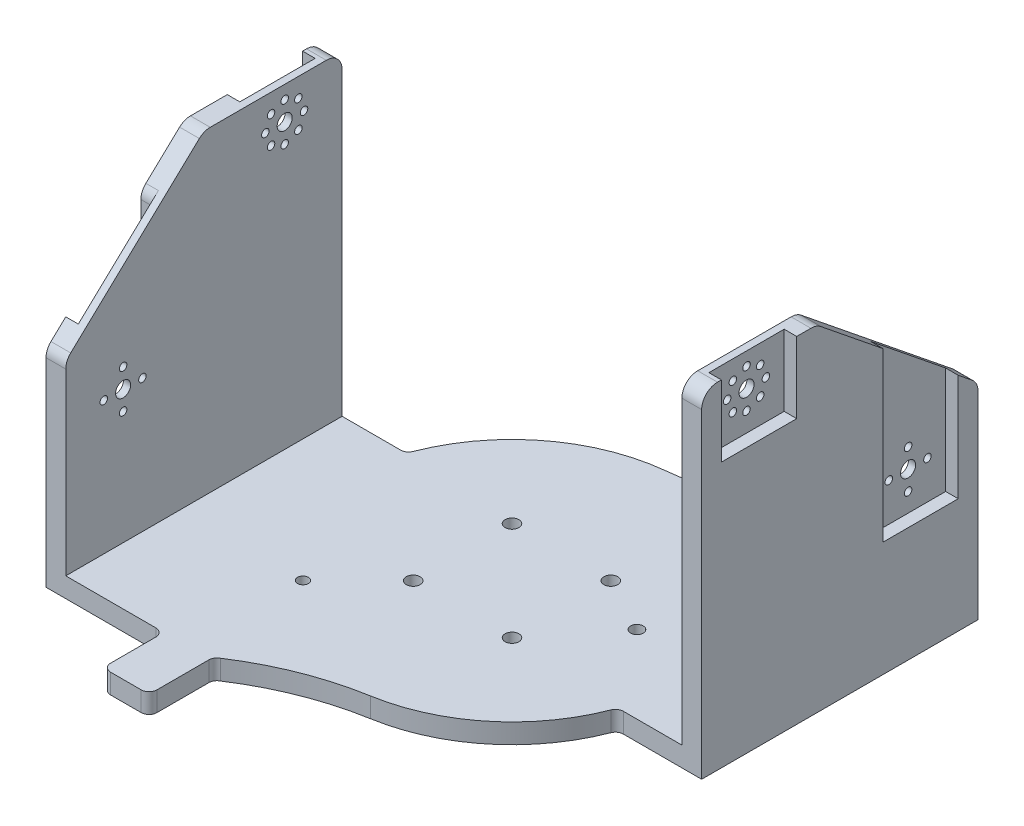
from build123d import *

# Parameters (mm, degrees)
SKETCH2_W                      = 230
SKETCH2_H                      = 283.251
BOSS_EXTRUDE1_DEPTH            = 10
SKETCH3_W                      = 10
SKETCH3_H                      = 283.251
BOSS_EXTRUDE2_DEPTH            = 170
M6_CLEARANCE_HOLE1_D           = 7
CUT_EXTRUDE1_DEPTH             = 327.431895271
CUT_EXTRUDE1_DEPTH_BACK        = 327.431895271
SKETCH7_R                      = 3.81
SKETCH7_R_2                    = 1.89865
SKETCH8_W                      = 6.35
SKETCH8_H                      = 38.1
CUT_EXTRUDE2_DEPTH             = 36.025
CUT_EXTRUDE3_DEPTH             = 6.35
CUT_EXTRUDE4_REACH             = 331.125
SKETCH11_R                     = 3.81
F_6_CLEARANCE_HOLE1_D          = 3.7973
F_6_CLEARANCE_HOLE1_DEPTH      = 3.65
CIRPATTERN1_COUNT              = 2
ENL_V_MAT_EXTRU_1_REACH        = 249.554
ESQUISSE1_R                    = 3.175
CBORE_FOR_M5_SHCS1_D           = 5.5
CBORE_FOR_M5_SHCS1_CBORE_D     = 10
CBORE_FOR_M5_SHCS1_CBORE_DEPTH = 5
CUT_EXTRUDE5_DEPTH             = 248.553594703
CUT_EXTRUDE5_DEPTH_BACK        = 248.553594703
SKETCH15_W                     = 58.825
SKETCH15_H                     = 30.860637148
CUT_EXTRUDE7_DEPTH             = 248.553594703
CUT_EXTRUDE7_DEPTH_BACK        = 248.553594703
SKETCH20_W                     = 0.765
SKETCH20_H                     = 30.860637148
FILLET2_R                      = 4
FILLET3_R                      = 144
FILLET4_R                      = 4
CUT_EXTRUDE8_REACH             = 335.853
CUT_EXTRUDE9_REACH             = 335.853
FILLET5_R                      = 8
FILLET6_R                      = 8


with BuildPart() as part:
    # Sketch2 → Boss-Extrude1 (new body)
    with BuildSketch(Plane(origin=(0, 0, 0), x_dir=(1, 0, 0), z_dir=(0, 1, 0))):
        Rectangle(SKETCH2_W, SKETCH2_H)
    extrude(amount=BOSS_EXTRUDE1_DEPTH)

    # Sketch3 → Boss-Extrude2 (add)
    with BuildSketch(Plane(origin=(0, 0, 0), x_dir=(1, 0, 0), z_dir=(0, 1, 0))):
        with Locations((-120, 0)):
            Rectangle(SKETCH3_W, SKETCH3_H)
        with Locations((120, 0)):
            Rectangle(SKETCH3_W, SKETCH3_H)
    extrude(amount=BOSS_EXTRUDE2_DEPTH)

    # M6 Clearance Hole1 (through all)
    with Locations(Plane(origin=(0, 10, 0), x_dir=(1, 0, 0), z_dir=(0, 1, 0))):
        with Locations((-25, 25), (25, 25), (25, -25), (-25, -25)):
            Hole(M6_CLEARANCE_HOLE1_D / 2)

    # Sketch7 → Cut-Extrude1 (cut, two sides: drawn at the far end of the back side and taken through both)
    with BuildSketch(Plane.ZY.offset(-115).offset(-CUT_EXTRUDE1_DEPTH_BACK)):
        with Locations((0, 153.49)):
            Circle(SKETCH7_R)
        with Locations((0, 163.269)):
            Circle(SKETCH7_R_2)
        with Locations((6.914797213, 160.404797213)):
            Circle(SKETCH7_R_2)
        with Locations((9.779, 153.49)):
            Circle(SKETCH7_R_2)
        with Locations((6.914797213, 146.575202787)):
            Circle(SKETCH7_R_2)
        with Locations((0, 143.711)):
            Circle(SKETCH7_R_2)
        with Locations((-6.914797213, 146.575202787)):
            Circle(SKETCH7_R_2)
        with Locations((-9.779, 153.49)):
            Circle(SKETCH7_R_2)
        with Locations((-6.914797213, 160.404797213)):
            Circle(SKETCH7_R_2)
    extrude(amount=CUT_EXTRUDE1_DEPTH + CUT_EXTRUDE1_DEPTH_BACK, mode=Mode.SUBTRACT)

    # Sketch8 → Cut-Extrude2 (cut)
    with BuildSketch(Plane(origin=(0, 170, 0), x_dir=(1, 0, 0), z_dir=(0, 1, 0))):
        with Locations((121.825, 0)):
            Rectangle(SKETCH8_W, SKETCH8_H)
        with Locations((-121.825, 0)):
            Rectangle(SKETCH8_W, SKETCH8_H)
    extrude(amount=-CUT_EXTRUDE2_DEPTH, mode=Mode.SUBTRACT)

    # Sketch9 → Cut-Extrude3 (cut)
    with BuildSketch(Plane(origin=(125, 0, 0), x_dir=(0, 0, -1), z_dir=(1, 0, 0))):
        Polygon((100.764862852, 96.554), (100.764862852, 58.026), (62.744862852, 58.026), (62.744862852, 96.554), (62.744862852, 170), (100.764862852, 170), align=None)
    cut_extrude3 = extrude(amount=-CUT_EXTRUDE3_DEPTH, mode=Mode.SUBTRACT)

    # Sketch11 → Cut-Extrude4 (cut, up to next)
    with BuildSketch(Plane(origin=(118.65, 0, 0), x_dir=(0, 0, -1), z_dir=(1, 0, 0)), mode=Mode.PRIVATE) as cut_extrude4_sk1:
        with Locations((81.754862852, 77.29)):
            Circle(SKETCH11_R)
    cut_extrude4_tool1 = extrude(cut_extrude4_sk1.sketch, amount=-CUT_EXTRUDE4_REACH, mode=Mode.PRIVATE) & part.part
    cut_extrude4 = cut_extrude4_tool1.solids().sort_by_distance((118.65, 77.29, -81.754863))[0]
    add(cut_extrude4, mode=Mode.SUBTRACT)

    # #6 Clearance Hole1
    with Locations(Plane(origin=(118.65, 0, 0), x_dir=(0, 0, -1), z_dir=(1, 0, 0))):
        with Locations((81.754862852, 87.069), (71.975862852, 77.29), (91.533862852, 77.29), (81.754862852, 67.511)):
            f_6_clearance_hole1 = Hole(F_6_CLEARANCE_HOLE1_D / 2, depth=F_6_CLEARANCE_HOLE1_DEPTH)

    # CirPattern1: Cut-Extrude3, Cut-Extrude4, #6 Clearance Hole1 ×2 about axis
    cirpattern1_axis = Axis((0, 0, 0), (0, 1, 0))
    add([cut_extrude3.rotate(cirpattern1_axis, i * 360 / CIRPATTERN1_COUNT) for i in range(1, CIRPATTERN1_COUNT)], mode=Mode.SUBTRACT)
    add([cut_extrude4.rotate(cirpattern1_axis, i * 360 / CIRPATTERN1_COUNT) for i in range(1, CIRPATTERN1_COUNT)], mode=Mode.SUBTRACT)
    add([f_6_clearance_hole1.rotate(cirpattern1_axis, i * 360 / CIRPATTERN1_COUNT) for i in range(1, CIRPATTERN1_COUNT)], mode=Mode.SUBTRACT)

    # Esquisse1 → Enlèv. mat.-Extru.1 (cut, up to next)
    with BuildSketch(Plane(origin=(0, 10, 0), x_dir=(1, 0, 0), z_dir=(0, 1, 0)), mode=Mode.PRIVATE) as enl_v_mat_extru_1_sk1:
        with Locations(Location((53, 110.739314032, 0), (0, 0, 270))):
            Circle(ESQUISSE1_R)
    enl_v_mat_extru_1_tool1 = extrude(enl_v_mat_extru_1_sk1.sketch, amount=-ENL_V_MAT_EXTRU_1_REACH, mode=Mode.PRIVATE) & part.part
    # Esquisse1 → Enlèv. mat.-Extru.1 (cut, up to next)
    with BuildSketch(Plane(origin=(0, 10, 0), x_dir=(1, 0, 0), z_dir=(0, 1, 0)), mode=Mode.PRIVATE) as enl_v_mat_extru_1_sk2:
        with Locations(Location((53, 10.203163452, 0), (0, 0, 270))):
            Circle(ESQUISSE1_R)
    enl_v_mat_extru_1_tool2 = extrude(enl_v_mat_extru_1_sk2.sketch, amount=-ENL_V_MAT_EXTRU_1_REACH, mode=Mode.PRIVATE) & part.part
    add(enl_v_mat_extru_1_tool1.solids().sort_by_distance((53, 10, -110.739314))[0], mode=Mode.SUBTRACT)
    add(enl_v_mat_extru_1_tool2.solids().sort_by_distance((53, 10, -10.203163))[0], mode=Mode.SUBTRACT)

    # CBORE for M5 SHCS1 (through all)
    with Locations(Plane(origin=(0, 0, 0), x_dir=(-1, 0, 0), z_dir=(0, -1, 0))):
        with Locations((53, -52.770411672), (53, -153.306562253)):
            CounterBoreHole(CBORE_FOR_M5_SHCS1_D / 2, CBORE_FOR_M5_SHCS1_CBORE_D / 2, CBORE_FOR_M5_SHCS1_CBORE_DEPTH)

    # Sketch15 → Cut-Extrude5 (cut, two sides: drawn at the far end of the back side and taken through both)
    with BuildSketch(Plane(origin=(0, 10, 0), x_dir=(1, 0, 0), z_dir=(0, 1, 0)).offset(-CUT_EXTRUDE5_DEPTH_BACK)):
        with BuildLine():
            Line((125, 141.6255), (-125, 141.6255))
            Line((-125, 141.6255), (-125, 29.05))
            Line((-125, 29.05), (-82.580571034, 29.05))
            ThreePointArc((-82.580571034, 29.05), (-32.48081845, 81.292371383), (39.825, 77.957825696))
            Line((39.825, 77.957825696), (39.825, 123.914314032))
            Line((39.825, 123.914314032), (66.175, 123.914314032))
            Line((66.175, 123.914314032), (66.175, 110.764862852))
            Line((66.175, 110.764862852), (125, 110.764862852))
            Line((125, 110.764862852), (125, 141.6255))
        make_face()
        with BuildLine():
            Line((125, -141.6255), (125, -29.05))
            Line((125, -29.05), (82.580571034, -29.05))
            ThreePointArc((82.580571034, -29.05), (32.48081845, -81.292371383), (-39.825, -77.957825696))
            Line((-39.825, -77.957825696), (-39.825, -141.6255))
            Line((-39.825, -141.6255), (125, -141.6255))
        make_face()
        with Locations((-95.5875, -126.195181426)):
            Rectangle(SKETCH15_W, SKETCH15_H)
    extrude(amount=CUT_EXTRUDE5_DEPTH + CUT_EXTRUDE5_DEPTH_BACK, mode=Mode.SUBTRACT)

    # Sketch20 → Cut-Extrude7 (cut, two sides: drawn at the far end of the back side and taken through both)
    with BuildSketch(Plane(origin=(0, 10, 0), x_dir=(1, 0, 0), z_dir=(0, 1, 0)).offset(-CUT_EXTRUDE7_DEPTH_BACK)):
        with Locations((-65.7925, -126.195181426)):
            Rectangle(SKETCH20_W, SKETCH20_H)
        with BuildLine():
            Line((-39.825, -141.6255), (-39.825, -107.748743461))
            ThreePointArc((-39.825, -107.748743461), (-41.410278355, -109.222344653), (-41.995854347, -111.306021378))
            Line((-41.995854347, -111.306021378), (-41.995854347, -141.6255))
            Line((-41.995854347, -141.6255), (-39.825, -141.6255))
        make_face()
        with BuildLine():
            Line((39.825, 123.914314032), (66.175, 123.914314032))
            Line((66.175, 123.914314032), (66.175, 110.764862852))
            Line((66.175, 110.764862852), (65.41, 110.764862852))
            Line((65.41, 110.764862852), (65.41, 116.58385488))
            ThreePointArc((65.41, 116.58385488), (64.238427125, 119.412282005), (61.41, 120.58385488))
            Line((61.41, 120.58385488), (46, 120.58385488))
            ThreePointArc((46, 120.58385488), (43.171572875, 119.412282005), (42, 116.58385488))
            Line((42, 116.58385488), (42, 104.58385488))
            ThreePointArc((42, 104.58385488), (41.413209633, 102.498189519), (39.825, 101.024448329))
            Line((39.825, 101.024448329), (39.825, 123.914314032))
        make_face()
    extrude(amount=CUT_EXTRUDE7_DEPTH + CUT_EXTRUDE7_DEPTH_BACK, mode=Mode.SUBTRACT)

    # Fillet2
    fillet2_edges = [part.edges().sort_by_distance(p)[0] for p in [
        (-65.41, 5, 141.6255),
        (-41.995854347, 5, 141.6255),
    ]]
    fillet(fillet2_edges, radius=FILLET2_R)

    # Fillet3
    # the kernel refuses this fillet: 144 mm, written as the material it adds along each edge
    with BuildSketch(Plane(origin=(39.825, 0, -77.957825696), x_dir=(-0.982886863529815, 0, -0.18421024265909586), z_dir=(0, 1, 0))) as fillet3_piece_1:
        with BuildLine():
            CenterArc((90.33197894, -138.109046644), FILLET3_R, 106.445268475, 20.267064332)
            Line((4.249108153, -22.671880372), (2.527450737, -20.363137046))
            ThreePointArc((2.527450737, -20.363137046), (-0.706160091, -11.866465685), (-2.830714167, -0.530525499))
            Line((-2.830714167, -0.530525499), (0.815326005, 2.762180933))
            ThreePointArc((0.815326005, 2.762180933), (24.782839351, -0.701255836), (48.750352698, 2.762180933))
            Line((48.750352698, 2.762180933), (49.565678703, 0))
        make_face()
    extrude(amount=10)
    with BuildSketch(Plane(origin=(-39.825, 10, 77.957825696), x_dir=(0, 0, 1), z_dir=(0, -1, 0))) as fillet3_piece_2:
        with BuildLine():
            CenterArc((150.266135455, -78.877892483), FILLET3_R, 146.786309889, 23.503480659)
            Line((8.329161454, -54.590129896), (5.490421974, -54.104374645))
            ThreePointArc((5.490421974, -54.104374645), (5.734767963, -27.055491549), (-2.564719952, -1.310195239))
            Line((-2.564719952, -1.310195239), (0, 2.88))
            ThreePointArc((0, 2.88), (14.895458882, 2.88), (27.381413411, 1.57755785))
            Line((27.381413411, 1.57755785), (29.790917765, 0))
        make_face()
    extrude(amount=10)

    # Fillet4
    fillet4_edges = [part.edges().sort_by_distance(p)[0] for p in [
        (-82.580571034, 5, -29.05),
        (82.580571034, 5, 29.05),
        (-65.41, 5, 110.764862852),
        (65.41, 5, -110.764862852),
    ]]
    fillet(fillet4_edges, radius=FILLET4_R)

    # Sketch22 → Cut-Extrude8 (cut, up to next)
    with BuildSketch(Plane.ZY.offset(125), mode=Mode.PRIVATE) as cut_extrude8_sk1:
        Polygon((40.857431426, 170), (110.764862852, 104.051), (110.764862852, 170), align=None)
    cut_extrude8_tool1 = extrude(cut_extrude8_sk1.sketch, amount=-CUT_EXTRUDE8_REACH, mode=Mode.PRIVATE) & part.part
    add(cut_extrude8_tool1.solids().sort_by_distance((-125, 148.017, 87.462386))[0], mode=Mode.SUBTRACT)

    # Sketch23 → Cut-Extrude9 (cut, up to next)
    with BuildSketch(Plane(origin=(125, 0, 0), x_dir=(0, 0, -1), z_dir=(1, 0, 0)), mode=Mode.PRIVATE) as cut_extrude9_sk1:
        Polygon((29.05, 170), (110.764862852, 104.051), (110.764862852, 170), align=None)
    cut_extrude9_tool1 = extrude(cut_extrude9_sk1.sketch, amount=-CUT_EXTRUDE9_REACH, mode=Mode.PRIVATE) & part.part
    add(cut_extrude9_tool1.solids().sort_by_distance((125, 148.017, -83.526575))[0], mode=Mode.SUBTRACT)

    # Fillet5
    fillet5_edges = [part.edges().sort_by_distance(p)[0] for p in [
        (-120, 170, -29.05),
        (120, 170, 29.05),
        (-120, 170, 40.857431426),
        (-120, 104.051, 110.764862852),
        (120, 170, -29.05),
        (120, 104.051, -110.764862852),
    ]]
    fillet(fillet5_edges, radius=FILLET5_R)

    # Fillet6
    fillet6_edges = [part.edges().sort_by_distance(p)[0] for p in [
        (-121.825, 149.351920308, 62.744862852),
    ]]
    fillet(fillet6_edges, radius=FILLET6_R)


solid = part.part
